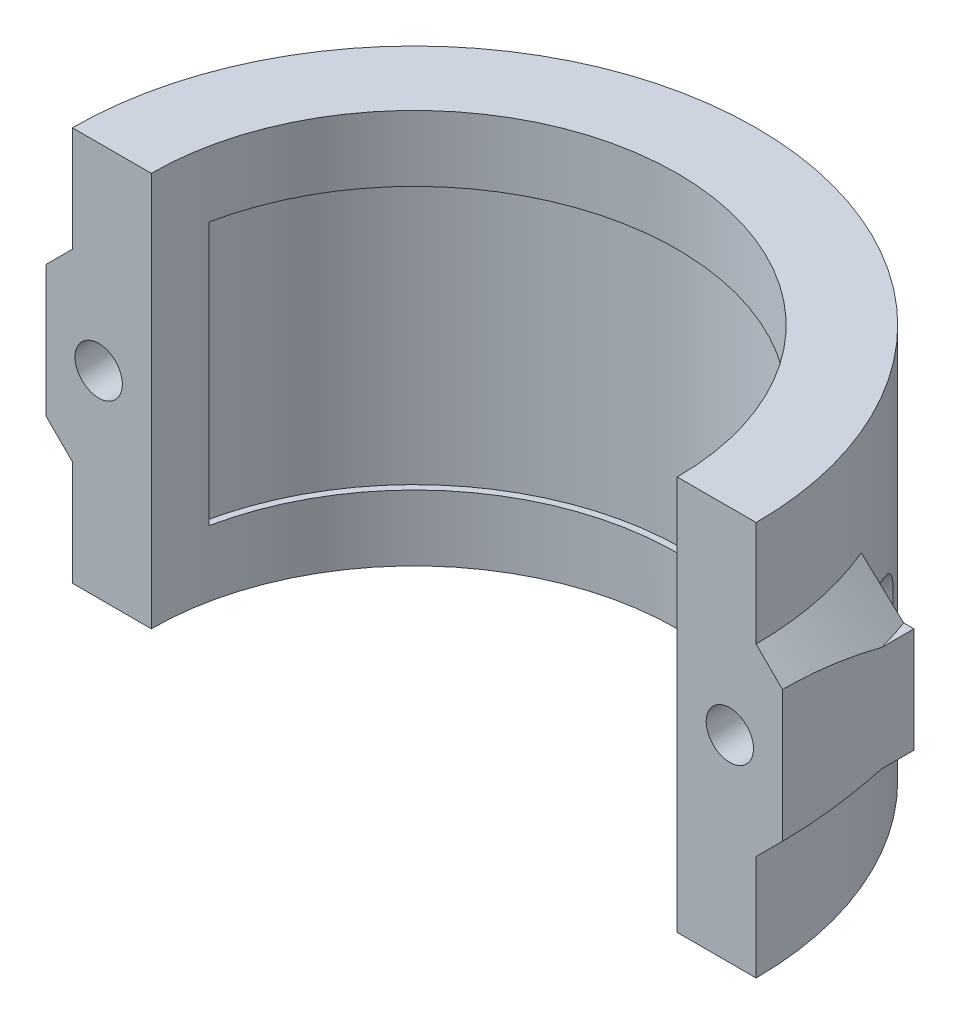
from build123d import *

# Parameters (mm, degrees)
BOSS_EXTRUDE1_DEPTH                          = 30
SKETCH2_W                                    = 8
SKETCH2_H                                    = 8
BOSS_EXTRUDE2_DEPTH                          = 10
CBORE_FOR_M3_HEX_SOCKET_HEAD_CAP_SCR_2_COUNT = 2
CBORE_FOR_M3_HEX_SOCKET_HEAD_CAP_SCR_2_PITCH = 48
SKETCH21_R                                   = 3.25
CUT_EXTRUDE2_DEPTH                           = 46.391188572
CUT_EXTRUDE3_START                           = -25
CUT_EXTRUDE3_DEPTH                           = 20
CHAMFER1_SIZE                                = 3


with BuildPart() as part:
    # Sketch1 → Boss-Extrude1 (new body)
    with BuildSketch(Plane(origin=(0, 0, 0), x_dir=(1, 0, 0), z_dir=(0, 1, 0))):
        with BuildLine():
            Line((26, 0), (20, 0))
            ThreePointArc((20, 0), (0, 20), (-20, 0))
            Line((-20, 0), (-26, 0))
            ThreePointArc((-26, 0), (0, 26), (26, 0))
        make_face()
    extrude(amount=BOSS_EXTRUDE1_DEPTH)

    # Sketch2 → Boss-Extrude2 (add)
    with BuildSketch(Plane.XY):
        with Locations((24, 15)):
            Rectangle(SKETCH2_W, SKETCH2_H)
        with Locations((-24, 15)):
            Rectangle(SKETCH2_W, SKETCH2_H)
    extrude(amount=-BOSS_EXTRUDE2_DEPTH)

    # Sketch20 → CBORE for M3 Hex Socket Head Cap Screw4 (revolve, cut)
    with BuildSketch(Plane(origin=(24, 15, -10), x_dir=(0, 1, 0), z_dir=(1, 0, 0))):
        Polygon((0, 0), (0, 10), (1.8, 10), (1.8, 3.4), (3.25, 3.4), (3.25, 0), align=None)
    cbore_for_m3_hex_socket_head_cap_screw4 = revolve(axis=Axis((24, 15, -16.35), (0, 0, 1)), mode=Mode.SUBTRACT)

    # CBORE for M3 Hex Socket Head Cap Scr 2: CBORE for M3 Hex Socket Head Cap Screw4 ×2
    with Locations(*[(-i * CBORE_FOR_M3_HEX_SOCKET_HEAD_CAP_SCR_2_PITCH, 0, 0) for i in range(1, CBORE_FOR_M3_HEX_SOCKET_HEAD_CAP_SCR_2_COUNT)]):
        add(cbore_for_m3_hex_socket_head_cap_screw4, mode=Mode.SUBTRACT)

    # Sketch21 → Cut-Extrude2 (cut, through all)
    with BuildSketch(Plane(origin=(0, 0, -6.6), x_dir=(-1, 0, 0), z_dir=(0, 0, -1))):
        with Locations((24, 15)):
            Circle(SKETCH21_R)
        with Locations((-24, 15)):
            Circle(SKETCH21_R)
    extrude(amount=CUT_EXTRUDE2_DEPTH, mode=Mode.SUBTRACT)

    # Sketch22 → Cut-Extrude3 (cut)
    with BuildSketch(Plane(origin=(0, 30, 0), x_dir=(1, 0, 0), z_dir=(0, 1, 0)).offset(CUT_EXTRUDE3_START)):
        with BuildLine():
            Line((-20.105969263, 4), (-19.595917942, 4))
            ThreePointArc((-19.595917942, 4), (0, 20), (19.595917942, 4))
            Line((19.595917942, 4), (20.105969263, 4))
            ThreePointArc((20.105969263, 4), (0, 20.5), (-20.105969263, 4))
        make_face()
    extrude(amount=CUT_EXTRUDE3_DEPTH, mode=Mode.SUBTRACT)

    # Chamfer1
    # the kernel refuses this chamfer: 3 mm, written as the material it adds along each edge
    with BuildSketch(Plane(origin=(0, 11, 0), x_dir=(0.7702703819055875, 0, -0.6377174442956852), z_dir=(-0.6377174442956852, 0, -0.7702703819055875))) as chamfer1_piece_1_section:
        Polygon((26, CHAMFER1_SIZE), (26 + CHAMFER1_SIZE, 0), (26, 0), align=None)
    chamfer1_piece_1 = revolve(axis=Axis((0, 11, 0), (0, -1, 0)), revolution_arc=39.621824877, mode=Mode.PRIVATE)
    chamfer1_piece_1 = split(chamfer1_piece_1, bisect_by=Plane(origin=(26.235677781, 9.966963305, -10), z_dir=(0, 0, 1)), keep=Keep.TOP, mode=Mode.PRIVATE)
    chamfer1_piece_1 = split(chamfer1_piece_1, bisect_by=Plane(origin=(28, 9.966963305, -5.200282344), z_dir=(-1, 0, 0)), keep=Keep.TOP, mode=Mode.PRIVATE)
    add(chamfer1_piece_1)
    with BuildSketch(Plane(origin=(0, 19, 0), x_dir=(0.7702703819055875, 0, -0.6377174442956852), z_dir=(-0.6377174442956852, 0, -0.7702703819055875))) as chamfer1_piece_2_section:
        Polygon((26, -CHAMFER1_SIZE), (26 + CHAMFER1_SIZE, 0), (26, 0), align=None)
    chamfer1_piece_2 = revolve(axis=Axis((0, 19, 0), (0, -1, 0)), revolution_arc=39.621824877, mode=Mode.PRIVATE)
    chamfer1_piece_2 = split(chamfer1_piece_2, bisect_by=Plane(origin=(26.235677781, 20.033036695, -10), z_dir=(0, 0, 1)), keep=Keep.TOP, mode=Mode.PRIVATE)
    chamfer1_piece_2 = split(chamfer1_piece_2, bisect_by=Plane(origin=(28, 20.033036695, -5.200282344), z_dir=(-1, 0, 0)), keep=Keep.TOP, mode=Mode.PRIVATE)
    add(chamfer1_piece_2)
    with BuildSketch(Plane(origin=(0, 19, 0), x_dir=(-1, 0, 0), z_dir=(0, 0, 1))) as chamfer1_piece_3_section:
        Polygon((26, -CHAMFER1_SIZE), (26 + CHAMFER1_SIZE, 0), (26, 0), align=None)
    chamfer1_piece_3 = revolve(axis=Axis((0, 19, 0), (0, -1, 0)), revolution_arc=39.621824877, mode=Mode.PRIVATE)
    chamfer1_piece_3 = split(chamfer1_piece_3, bisect_by=Plane(origin=(-26.235677756, 20.033036715, -10), z_dir=(0, 0, 1)), keep=Keep.TOP, mode=Mode.PRIVATE)
    chamfer1_piece_3 = split(chamfer1_piece_3, bisect_by=Plane(origin=(-28, 20.033036715, -5.200282276), z_dir=(1, 0, 0)), keep=Keep.TOP, mode=Mode.PRIVATE)
    add(chamfer1_piece_3)
    with BuildSketch(Plane(origin=(0, 11, 0), x_dir=(-1, 0, 0), z_dir=(0, 0, 1))) as chamfer1_piece_4_section:
        Polygon((26, CHAMFER1_SIZE), (26 + CHAMFER1_SIZE, 0), (26, 0), align=None)
    chamfer1_piece_4 = revolve(axis=Axis((0, 11, 0), (0, -1, 0)), revolution_arc=39.621824877, mode=Mode.PRIVATE)
    chamfer1_piece_4 = split(chamfer1_piece_4, bisect_by=Plane(origin=(-26.235677756, 9.966963285, -10), z_dir=(0, 0, 1)), keep=Keep.TOP, mode=Mode.PRIVATE)
    chamfer1_piece_4 = split(chamfer1_piece_4, bisect_by=Plane(origin=(-28, 9.966963285, -5.200282276), z_dir=(1, 0, 0)), keep=Keep.TOP, mode=Mode.PRIVATE)
    add(chamfer1_piece_4)


solid = part.part
